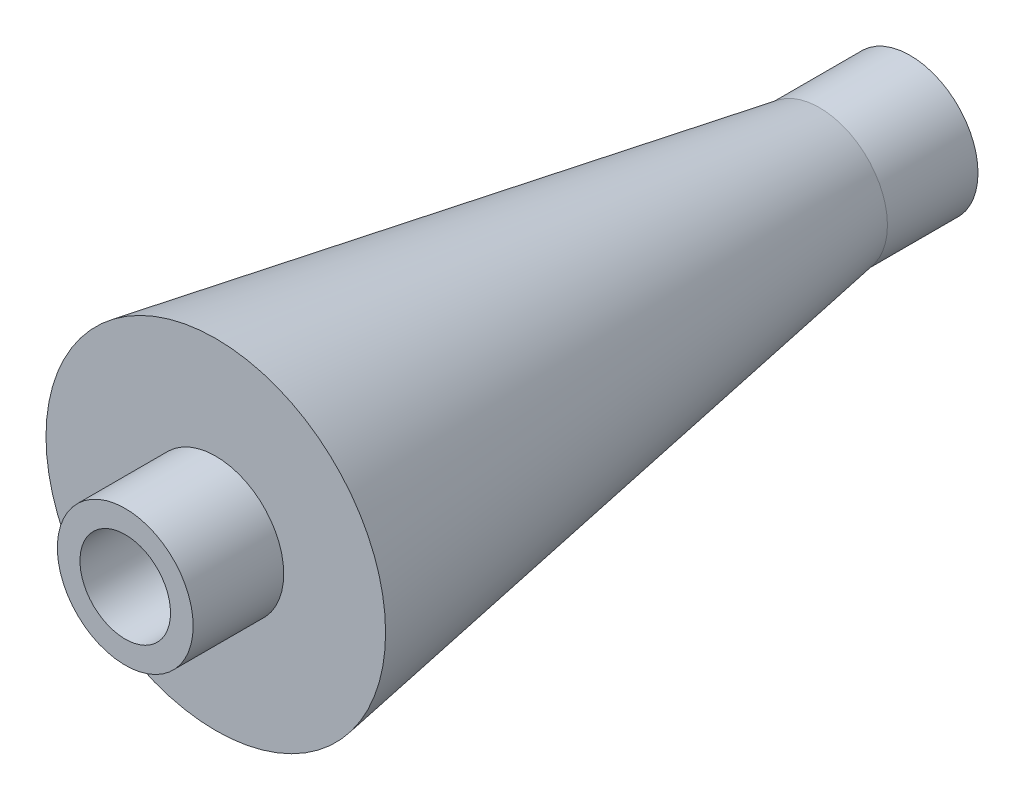
from build123d import *


with BuildPart() as part:
    # Sketch1 → Revolve1 (revolve)
    with BuildSketch(Plane(origin=(0, 0, 0), x_dir=(1, 0, 0), z_dir=(0, 1, 0))):
        Polygon((7.14375, 9.525), (7.14375, 19.05), (17.859375, 19.05), (7.14375, 82.55), (7.14375, 92.075), (4.7625, 92.075), (4.7625, 9.525), align=None)
    revolve(axis=Axis((0, 0, 1.5875), (0, 0, -1)))


solid = part.part
